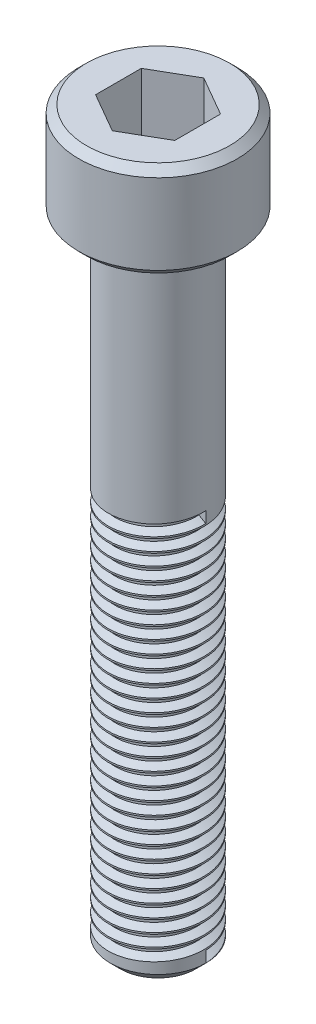
from build123d import *

# Parameters (mm, degrees)
CHAMFER1_SIZE      = 0.508
CHAMFER2_SIZE      = 0.381
THREAD2_PITCH      = 0.635
CUT_EXTRUDE2_DEPTH = 3.302


with BuildPart() as part:
    # Sketch1 → Revolve1 (revolve)
    with BuildSketch(Plane.XY, mode=Mode.PRIVATE) as revolve1_sk:
        Polygon((0, 0), (-2.3876, 0), (-2.3876, 31.75), (-3.9624, 31.75), (-3.9624, 36.5252), (0, 36.5252), align=None)
    revolve(revolve1_sk.sketch.rotate(Axis((0, 0, 0), (0, 1, 0)), 270), axis=Axis((0, 0, 0), (0, 1, 0)))

    # Chamfer1
    chamfer1_edges = [part.edges().sort_by_distance(p)[0] for p in [
        (0, 0, 2.3876),
    ]]
    chamfer(chamfer1_edges, length=CHAMFER1_SIZE)

    # Chamfer2
    chamfer2_edges = [part.edges().sort_by_distance(p)[0] for p in [
        (0, 36.5252, 3.9624),
        (0, 31.75, 3.9624),
    ]]
    chamfer(chamfer2_edges, length=CHAMFER2_SIZE)

    # Thread2: the profile of Thread Profile2 profile screwed along a right-hand helix of 30 turns, 6 arcs to a turn; built about Z, then put on its axis
    thread2_z = Axis((0, 0, 0), (0, 0, 1))
    thread2_corners = [(2.3879, 0, -0.000173205), (2.3879, 0, 0.555798203), (2.043896169, 0, 0.357187499), (2.043896169, 0, 0.198437499)]
    with BuildLine(mode=Mode.PRIVATE) as thread2_profile:
        Line(thread2_corners[0], thread2_corners[1])
        Line(thread2_corners[1], thread2_corners[2])
        Line(thread2_corners[2], thread2_corners[3])
        Line(thread2_corners[3], thread2_corners[0])
    thread2_cap = Face(thread2_profile.wire())
    thread2_turn_angles = [0, 30, 60, 90, 120, 150, 180, 210, 240, 270, 300, 330, 360]
    thread2_turn_weights = [1, 0.8660254037844387, 1, 0.8660254037844387, 1, 0.8660254037844387, 1, 0.8660254037844387, 1, 0.8660254037844387, 1, 0.8660254037844387, 1]
    thread2_turn_rails = [Edge.make_bspline([Vector(p[0], p[1], 0).rotate(thread2_z, thread2_turn_angles[k]) / thread2_turn_weights[k] + Vector(0, 0, p[2] + THREAD2_PITCH * thread2_turn_angles[k] / 360) for k in range(13)], [0, 0, 0, 1, 1, 2, 2, 3, 3, 4, 4, 5, 5, 6, 6, 6], 2, thread2_turn_weights) for p in thread2_corners]
    thread2_turn_sides = [Face.make_surface_from_curves(thread2_turn_rails[p[0]], thread2_turn_rails[p[1]]) for p in [(0, 1), (1, 2), (2, 3), (3, 0)]]
    thread2 = Plane(origin=(0, 0.508, 0), x_dir=(1, 0, 0), z_dir=(0, 1, 0)) * Solid(Shell([*[p.moved(Location((0, 0, THREAD2_PITCH * i))) for i in range(30) for p in thread2_turn_sides], thread2_cap, thread2_cap.rotate(thread2_z, 10800).moved(Location((0, 0, THREAD2_PITCH * 10800 / 360)))]))
    add(thread2, mode=Mode.SUBTRACT)

    # Sketch10 → Cut-Extrude2 (cut)
    with BuildSketch(Plane(origin=(0, 36.5252, 0), x_dir=(1, 0, 0), z_dir=(0, 1, 0))):
        Polygon((-1.9812, 1.143846353), (-1.9812, -1.143846353), (0, -2.287692707), (1.9812, -1.143846353), (1.9812, 1.143846353), (0, 2.287692707), align=None)
    extrude(amount=-CUT_EXTRUDE2_DEPTH, mode=Mode.SUBTRACT)


solid = part.part
